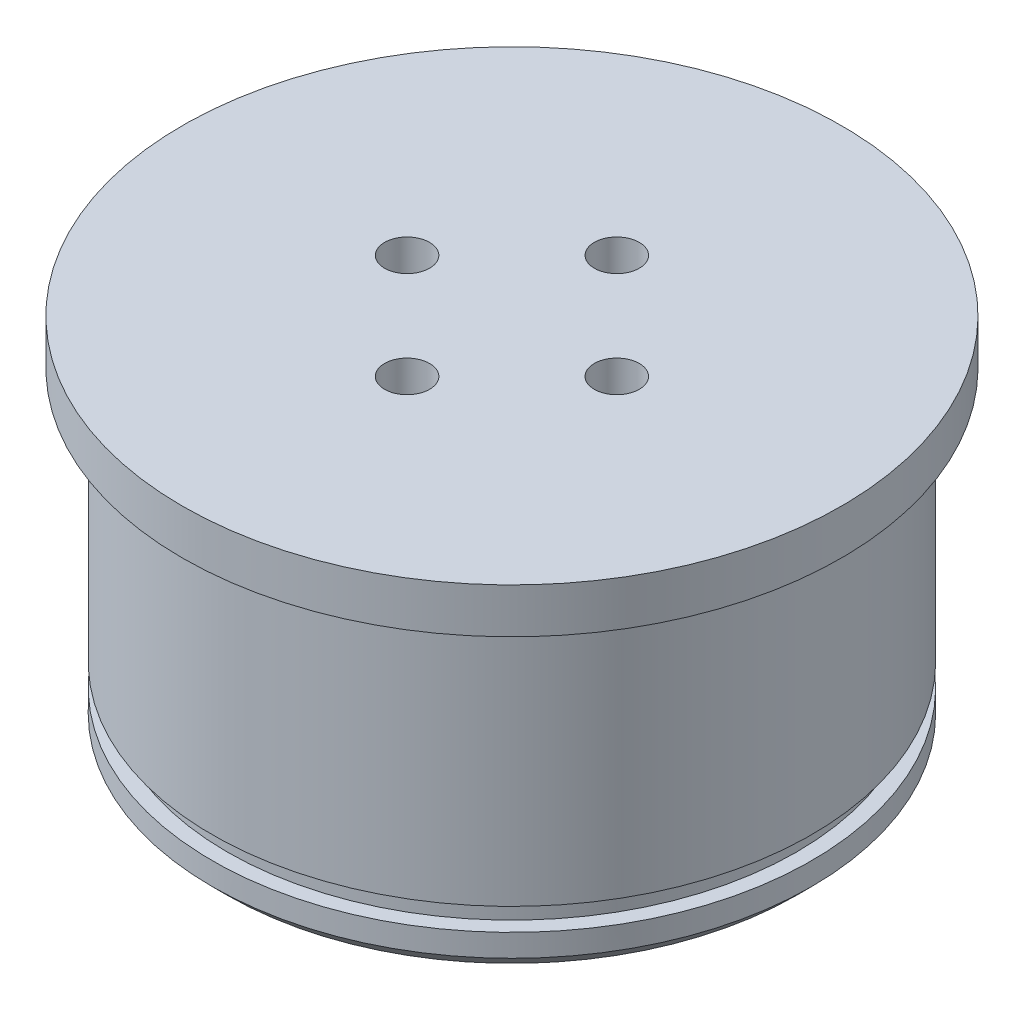
from build123d import *

# Parameters (mm, degrees)
SKETCH_1_R               = 20
EXTRUDE_1_DEPTH          = 21
SKETCH_2_R               = 10
CUT_EXTRUDE_2_DEPTH      = 2.5
SKETCH_5_R               = 20
SKETCH_5_R_2             = 19
CUT_EXTRUDE_5_DEPTH      = 1.5
CHAMFER_1_SIZE           = 1
SKETCH_6_R               = 22
EXTRUDE_2_DEPTH          = 3
SKETCH_4_R               = 1.5
CUT_EXTRUDE_6_DEPTH      = 38.818646195
PATTERN_CIRCULAR_1_COUNT = 4


with BuildPart() as part:
    # Эскиз1 → Бобышка-Вытянуть1 (new body)
    with BuildSketch(Plane(origin=(0, 0, 0), x_dir=(1, 0, 0), z_dir=(0, 1, 0))):
        Circle(SKETCH_1_R)
    extrude(amount=EXTRUDE_1_DEPTH)

    # Эскиз2 → Вырез-Вытянуть2 (cut)
    with BuildSketch(Plane.XZ):
        Circle(SKETCH_2_R)
    extrude(amount=-CUT_EXTRUDE_2_DEPTH, mode=Mode.SUBTRACT)

    # Эскиз5 → Вырез-Вытянуть5 (cut)
    with BuildSketch(Plane(origin=(0, 2.5, 0), x_dir=(-1, 0, 0), z_dir=(0, -1, 0))):
        Circle(SKETCH_5_R)
        Circle(SKETCH_5_R_2, mode=Mode.SUBTRACT)
    extrude(amount=-CUT_EXTRUDE_5_DEPTH, mode=Mode.SUBTRACT)

    # Фаска1
    chamfer_1_edges = [part.edges().sort_by_distance(p)[0] for p in [
        (-20, 0, 0),
    ]]
    chamfer(chamfer_1_edges, length=CHAMFER_1_SIZE)

    # Эскиз6 → Бобышка-Вытянуть2 (add)
    with BuildSketch(Plane(origin=(0, 21, 0), x_dir=(1, 0, 0), z_dir=(0, 1, 0))):
        Circle(SKETCH_6_R)
    extrude(amount=EXTRUDE_2_DEPTH)

    # Эскиз4 → Вырез-Вытянуть6 (cut, through all)
    with BuildSketch(Plane.XZ.offset(-2.5)):
        with Locations((0, 7)):
            Circle(SKETCH_4_R)
    cut_extrude_6 = extrude(amount=-CUT_EXTRUDE_6_DEPTH, mode=Mode.SUBTRACT)

    # Круговой массив1: Вырез-Вытянуть6 ×4 about axis
    pattern_circular_1_axis = Axis((0, 2.5, 0), (0, -1, 0))
    for i in range(1, PATTERN_CIRCULAR_1_COUNT):
        add(cut_extrude_6.rotate(pattern_circular_1_axis, i * 360 / PATTERN_CIRCULAR_1_COUNT), mode=Mode.SUBTRACT)


solid = part.part
